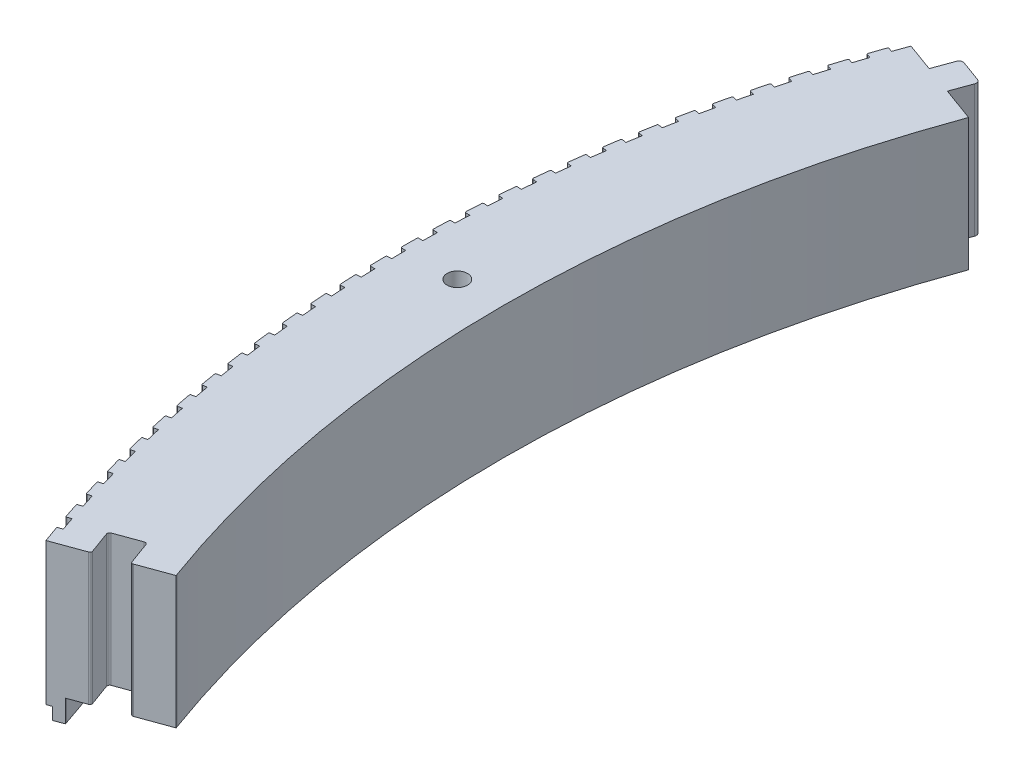
from build123d import *

# Parameters (mm, degrees)
CUT_EXTRUDE4_DEPTH         = 448.090797114
TONGUE_DEPTH               = 33.02
GROOVE_REACH               = 337.962
NOTCH_DEPTH                = 336.961837561
FILLET_NOTCH_R             = 0.254
CIRPATTERN_NOTCHES_START   = -35.56
CIRPATTERN_NOTCHES_DEPTH   = 35.56
CUT_EXTRUDE6_DEPTH         = 38.608
SKETCH4_R                  = 2.1971
HOLES_MOUNTINGBOTTOM_DEPTH = 27.94
SKETCH9_R                  = 2.5527
HOLES_MOUNTINGTOP_DEPTH    = 336.365614775
HEXHOLE_DEPTH              = 25.4
SKETCH13_W                 = 8.8519
SKETCH13_H                 = 33.02
EXTENDLENGTH_DEPTH         = 0.3556
FILLET_GROOVE_R            = 0.508
RELIEF_VERSIONNUMBER_DEPTH = 0.6


# Read off the part's stored shape, not the designer's step: CirPattern-Notches
with BuildPart() as part:
    # Sketch1 → Revolve1 (revolve)
    with BuildSketch(Plane.XY, mode=Mode.PRIVATE) as revolve1_sk:
        Polygon((-289.56, 0), (-314.96, 0), (-314.96, -35.56), (-313.69, -35.56), (-313.69, -38.608), (-311.15, -38.608), (-311.15, -33.02), (-289.56, -33.02), align=None)
    revolve(revolve1_sk.sketch.rotate(Axis((0, 4.1402, 0), (0, -1, 0)), 270), axis=Axis((0, 4.1402, 0), (0, -1, 0)))

    # Sketch3 → Cut-Extrude4 (cut, through all)
    with BuildSketch(Plane(origin=(0, 0, 0), x_dir=(1, 0, 0), z_dir=(0, 1, 0))):
        with BuildLine():
            Line((-340.36, 123.880908935), (0, 0))
            Line((0, 0), (-170.18, -61.940454467))
            Line((-170.18, -61.940454467), (-170.180868731, -61.938067648))
            Line((-170.180868731, -61.938067648), (-340.36, -123.878205923))
            Line((-340.36, -123.878205923), (-340.36, -123.880908935))
            ThreePointArc((-340.36, -123.880908935), (362.20354664, 0), (-340.36, 123.880908935))
        make_face()
    extrude(amount=-CUT_EXTRUDE4_DEPTH, mode=Mode.SUBTRACT)

    # Sketch5 → Tongue (add)
    with BuildSketch(Plane(origin=(0, 0, 0), x_dir=(1, 0, 0), z_dir=(0, 1, 0))):
        with BuildLine():
            Line((-280.451262674, 102.075911776), (-278.626927229, 107.088232215))
            ThreePointArc((-278.626927229, 107.088232215), (-278.66084622, 107.865104834), (-279.234162466, 108.390452383))
            Line((-279.234162466, 108.390452383), (-284.485164831, 110.301660944))
            ThreePointArc((-284.485164831, 110.301660944), (-285.262037451, 110.267741953), (-285.787384999, 109.694425707))
            Line((-285.787384999, 109.694425707), (-287.611720444, 104.682105268))
            Line((-287.611720444, 104.682105268), (-280.451262674, 102.075911776))
        make_face()
    extrude(amount=-TONGUE_DEPTH)

    # Sketch6 → Groove (cut, up to next)
    with BuildSketch(Plane(origin=(0, 0, 0), x_dir=(1, 0, 0), z_dir=(0, 1, 0)), mode=Mode.PRIVATE) as groove_sk1:
        with BuildLine():
            Line((-128.707819823, -518.876197579), (-280.416329106, -102.060493985))
            Line((-280.416329106, -102.060493985), (-282.457847341, -96.451468732))
            ThreePointArc((-282.457847341, -96.451468732), (-282.786189559, -96.093146078), (-283.271734947, -96.071946709))
            Line((-283.271734947, -96.071946709), (-289.310387666, -98.269836554))
            ThreePointArc((-289.310387666, -98.269836554), (-289.66871032, -98.598178772), (-289.689909689, -99.083724159))
            Line((-289.689909689, -99.083724159), (-287.648391454, -104.692749412))
            Line((-287.648391454, -104.692749412), (-135.939882171, -521.508453006))
            Line((-135.939882171, -521.508453006), (167.477136395, -1355.139860195))
            Line((167.477136395, -1355.139860195), (174.709198743, -1352.507604768))
            Line((174.709198743, -1352.507604768), (-128.707819823, -518.876197579))
        make_face()
    groove_tool1 = extrude(groove_sk1.sketch, amount=-GROOVE_REACH, mode=Mode.PRIVATE) & part.part
    add(groove_tool1.solids().sort_by_distance((-57.595102, 0, 725.507875))[0], mode=Mode.SUBTRACT)

    # Sketch7 → Notch (cut, through all)
    with BuildSketch(Plane(origin=(0, 0, 0), x_dir=(1, 0, 0), z_dir=(0, 1, 0))):
        with BuildLine():
            Line((-296.152118835, -103.418270192), (-297.351115267, -103.836967642))
            ThreePointArc((-297.351115267, -103.836967642), (-297.935324969, -102.148635505), (-298.509948564, -100.457016721))
            Line((-298.509948564, -100.457016721), (-297.306279416, -100.051948106))
            ThreePointArc((-297.306279416, -100.051948106), (-296.733972852, -101.736745845), (-296.152118835, -103.418270192))
        make_face()
    extrude(amount=-NOTCH_DEPTH, mode=Mode.SUBTRACT)

    # Fillet-Notch
    fillet_notch_edges = [part.edges().sort_by_distance(p)[0] for p in [
        (-297.351115267, -17.78, 103.836967642),
        (-298.509948564, -17.78, 100.457016721),
    ]]
    fillet(fillet_notch_edges, radius=FILLET_NOTCH_R)

    # CirPattern-Notches outline → CirPattern-Notches (cut)
    with BuildSketch(Plane(origin=(0, 0, 0), x_dir=(1, 0, 0), z_dir=(0, 1, 0)).offset(CIRPATTERN_NOTCHES_START)):
        with BuildLine():
            ThreePointArc((-296.049225252, 103.712450206), (-295.456175483, 105.390058682), (-294.853619373, 107.064276219))
            Line((-294.853619373, 107.064276219), (-295.808923812, 107.411156744))
            ThreePointArc((-295.808923812, 107.411156744), (-295.949150754, 107.535782222), (-295.965587843, 107.722664342))
            ThreePointArc((-295.965587843, 107.722664342), (-296.6548527, 105.809734758), (-297.331753767, 103.892395304))
            ThreePointArc((-297.331753767, 103.892395304), (-297.202186047, 104.037452641), (-297.007992402, 104.048327086))
            Line((-297.007992402, 104.048327086), (-296.049225252, 103.712450206))
        make_face()
        with BuildLine():
            ThreePointArc((-298.54187051, 96.302479991), (-297.990812137, 97.994346681), (-297.430165872, 99.683060391))
            Line((-297.430165872, 99.683060391), (-298.393405254, 100.005887933))
            ThreePointArc((-298.393405254, 100.005887933), (-298.540105496, 100.133592529), (-298.553459144, 100.327631455))
            ThreePointArc((-298.553459144, 100.327631455), (-299.197252673, 98.391084927), (-299.828485072, 96.450407668))
            ThreePointArc((-299.828485072, 96.450407668), (-299.702572525, 96.598648875), (-299.50871019, 96.614359389))
            Line((-299.50871019, 96.614359389), (-298.54187051, 96.302479991))
        make_face()
        with BuildLine():
            ThreePointArc((-300.849079824, 88.832692568), (-300.340355132, 90.537766588), (-299.821966951, 92.239927544))
            Line((-299.821966951, 92.239927544), (-300.792952275, 92.538650205))
            ThreePointArc((-300.792952275, 92.538650205), (-300.942789448, 92.662659264), (-300.960974538, 92.856305146))
            ThreePointArc((-300.960974538, 92.856305146), (-301.556307988, 90.904316251), (-302.138981268, 88.94851094))
            ThreePointArc((-302.138981268, 88.94851094), (-302.016802103, 89.099843939), (-301.823391493, 89.120380764))
            Line((-301.823391493, 89.120380764), (-300.849079824, 88.832692568))
        make_face()
        with BuildLine():
            ThreePointArc((-302.969420098, 81.307727711), (-302.503345075, 83.024949974), (-302.027536968, 84.739500899))
            Line((-302.027536968, 84.739500899), (-303.005665118, 85.013933131))
            ThreePointArc((-303.005665118, 85.013933131), (-303.158546151, 85.134169626), (-303.181551389, 85.327302181))
            ThreePointArc((-303.181551389, 85.327302181), (-303.728054975, 83.361083375), (-304.261807215, 81.391364839))
            ThreePointArc((-304.261807215, 81.391364839), (-304.143437323, 81.545695632), (-303.950598573, 81.57104601))
            Line((-303.950598573, 81.57104601), (-302.969420098, 81.307727711))
        make_face()
        with BuildLine():
            ThreePointArc((-304.901574305, 73.732259469), (-304.478438448, 75.460563341), (-304.045505959, 77.18643926))
            Line((-304.045505959, 77.18643926), (-305.030169382, 77.436410603))
            ThreePointArc((-305.030169382, 77.436410603), (-305.185999315, 77.55279985), (-305.21381041, 77.745299118))
            ThreePointArc((-305.21381041, 77.745299118), (-305.711144678, 75.766071695), (-306.195644344, 73.783663402))
            ThreePointArc((-306.195644344, 73.783663402), (-306.081157248, 73.940896128), (-305.889010138, 73.971044314))
            Line((-305.889010138, 73.971044314), (-304.901574305, 73.732259469))
        make_face()
        with BuildLine():
            ThreePointArc((-306.644342309, 66.110993259), (-306.264408445, 67.849305223), (-305.874620485, 69.585434128))
            Line((-305.874620485, 69.585434128), (-306.865207567, 69.810789314))
            ThreePointArc((-306.865207567, 69.810789314), (-307.023889609, 69.92325902), (-307.056489287, 70.115005431))
            ThreePointArc((-307.056489287, 70.115005431), (-307.504345322, 68.123998767), (-307.939291473, 66.130132068))
            ThreePointArc((-307.939291473, 66.130132068), (-307.828758286, 66.290169063), (-307.637422166, 66.325096331))
            Line((-307.637422166, 66.325096331), (-306.644342309, 66.110993259))
        make_face()
        with BuildLine():
            ThreePointArc((-308.19664161, 58.448662944), (-307.860145731, 60.195903268), (-307.513744412, 61.941206781))
            Line((-307.513744412, 61.941206781), (-308.509639862, 62.141805835))
            ThreePointArc((-308.509639862, 62.141805835), (-308.671075447, 62.250286141), (-308.708443461, 62.441160593))
            ThreePointArc((-308.708443461, 62.441160593), (-309.106543083, 60.439611379), (-309.491665555, 58.435524742))
            ThreePointArc((-309.491665555, 58.435524742), (-309.385154934, 58.598266601), (-309.19474865, 58.637951256))
            Line((-309.19474865, 58.637951256), (-308.19664161, 58.448662944))
        make_face()
        with BuildLine():
            ThreePointArc((-309.557508015, 50.750027897), (-309.26465913, 52.505111301), (-308.961859616, 54.258505347))
            Line((-308.961859616, 54.258505347), (-309.962444844, 54.434223667))
            ThreePointArc((-309.962444844, 54.434223667), (-310.1265337, 54.538647191), (-310.168646837, 54.728531126))
            ThreePointArc((-310.168646837, 54.728531126), (-310.516742771, 52.717682602), (-310.851802352, 50.704620844))
            ThreePointArc((-310.851802352, 50.704620844), (-310.749380454, 50.869966482), (-310.560022274, 50.914383873))
            Line((-310.560022274, 50.914383873), (-309.557508015, 50.750027897))
        make_face()
        with BuildLine():
            ThreePointArc((-310.726096235, 43.019870037), (-310.477076246, 44.781706372), (-310.218066616, 46.54210185))
            Line((-310.218066616, 46.54210185), (-311.222720121, 46.692830291))
            ThreePointArc((-311.222720121, 46.692830291), (-311.389360326, 46.793132171), (-311.436192428, 46.981907644))
            ThreePointArc((-311.436192428, 46.981907644), (-311.734068458, 44.963008826), (-312.018857028, 42.942222337))
            ThreePointArc((-312.018857028, 42.942222337), (-311.920587472, 43.110069052), (-311.732395014, 43.159191591))
            Line((-311.732395014, 43.159191591), (-310.726096235, 43.019870037))
        make_face()
        with BuildLine():
            ThreePointArc((-311.701680417, 35.262990866), (-311.496643998, 37.030485786), (-311.281585135, 38.796789246))
            Line((-311.281585135, 38.796789246), (-312.289682886, 38.922434186))
            ThreePointArc((-312.289682886, 38.922434186), (-312.458770933, 39.018552121), (-312.510292912, 39.206101876))
            ThreePointArc((-312.510292912, 39.206101876), (-312.757764015, 37.180406781), (-312.992104681, 35.15315075))
            ThreePointArc((-312.992104681, 35.15315075), (-312.898048506, 35.323394284), (-312.711138664, 35.377191459))
            Line((-312.711138664, 35.377191459), (-311.701680417, 35.262990866))
        make_face()
        with BuildLine():
            ThreePointArc((-312.483654587, 27.484208483), (-312.322729094, 29.256264129), (-312.151754578, 31.027378451))
            Line((-312.151754578, 31.027378451), (-313.162670408, 31.127861845))
            ThreePointArc((-313.162670408, 31.127861845), (-313.334101269, 31.219736133), (-313.390281122, 31.405943677))
            ThreePointArc((-313.390281122, 31.405943677), (-313.587193585, 29.374710542), (-313.770940789, 27.342244176))
            ThreePointArc((-313.770940789, 27.342244176), (-313.681156416, 27.514778785), (-313.495645288, 27.573217181))
            Line((-313.495645288, 27.573217181), (-312.483654587, 27.484208483))
        make_face()
        with BuildLine():
            ThreePointArc((-313.071533029, 19.688354591), (-312.954818421, 21.46387027), (-312.828034451, 23.238695346))
            Line((-312.828034451, 23.238695346), (-313.84114044, 23.313954782))
            ThreePointArc((-313.84114044, 23.313954782), (-314.014807633, 23.401528356), (-314.075610465, 23.586278026))
            ThreePointArc((-314.075610465, 23.586278026), (-314.221841978, 21.55076853), (-314.354881587, 19.514354273))
            ThreePointArc((-314.354881587, 19.514354273), (-314.269424786, 19.68907279), (-314.085427598, 19.752116107))
            Line((-314.085427598, 19.752116107), (-313.071533029, 19.688354591))
        make_face()
        with BuildLine():
            ThreePointArc((-313.464950591, 11.880271497), (-313.392519362, 13.658144368), (-313.310004689, 15.435577786))
            Line((-313.310004689, 15.435577786), (-314.324671557, 15.485566516))
            ThreePointArc((-314.324671557, 15.485566516), (-314.500467212, 15.568784981), (-314.565855255, 15.751962023))
            ThreePointArc((-314.565855255, 15.751962023), (-314.661314988, 13.713440499), (-314.743564366, 11.674343247))
            ThreePointArc((-314.743564366, 11.674343247), (-314.662488217, 11.851137147), (-314.480119258, 11.918746228))
            Line((-314.480119258, 11.918746228), (-313.464950591, 11.880271497))
        make_face()
        with BuildLine():
            ThreePointArc((-313.663662904, 4.064809106), (-313.635560045, 5.843934862), (-313.597365922, 7.622872589))
            Line((-313.597365922, 7.622872589), (-314.612963421, 7.647559564))
            ThreePointArc((-314.612963421, 7.647559564), (-314.790778343, 7.726371229), (-314.860710983, 7.907861865))
            ThreePointArc((-314.860710983, 7.907861865), (-314.905339641, 5.867594518), (-314.936747701, 3.827080833))
            ThreePointArc((-314.936747701, 3.827080833), (-314.860102563, 4.005840302), (-314.679475109, 4.077973152))
            Line((-314.679475109, 4.077973152), (-313.663662904, 4.064809106))
        make_face()
        with BuildLine():
            ThreePointArc((-313.667546542, -3.753178095), (-313.683789509, -1.973904537), (-313.689939659, -0.194567469))
            Line((-313.689939659, -0.194567469), (-314.705836962, -0.195197584))
            ThreePointArc((-314.705836962, -0.195197584), (-314.885560704, -0.120841672), (-314.959994502, 0.058849827))
            ThreePointArc((-314.959994502, 0.058849827), (-314.953764366, -1.981896054), (-314.934311597, -4.022558729))
            ThreePointArc((-314.934311597, -4.022558729), (-314.862145078, -3.841944725), (-314.683371324, -3.765332911))
            Line((-314.683371324, -3.765332911), (-313.667546542, -3.753178095))
        make_face()
        with BuildLine():
            ThreePointArc((-313.476599092, -11.568834052), (-313.537177795, -9.790517869), (-313.587668399, -8.011886675))
            Line((-313.587668399, -8.011886675), (-314.603234492, -8.037833487))
            ThreePointArc((-314.603234492, -8.037833487), (-314.78475542, -7.967979513), (-314.863644143, -7.790198765))
            ThreePointArc((-314.863644143, -7.790198765), (-314.806559082, -9.830155593), (-314.736257569, -11.869699724))
            ThreePointArc((-314.736257569, -11.869699724), (-314.668614494, -11.687343371), (-314.491805483, -11.60630018))
            Line((-314.491805483, -11.60630018), (-313.476599092, -11.568834052))
        make_face()
        with BuildLine():
            ThreePointArc((-313.090939159, -19.377304157), (-313.19581597, -17.60104993), (-313.290615666, -15.824229386))
            Line((-313.290615666, -15.824229386), (-314.305219742, -15.87547678))
            ThreePointArc((-314.305219742, -15.87547678), (-314.488425107, -15.810168133), (-314.571719754, -15.634408562))
            ThreePointArc((-314.571719754, -15.634408562), (-314.463815225, -17.672309241), (-314.342708635, -19.709467988))
            ThreePointArc((-314.342708635, -19.709467988), (-314.279631019, -19.525482555), (-314.104896575, -19.440058325))
            Line((-314.104896575, -19.440058325), (-313.090939159, -19.377304157))
        make_face()
        with BuildLine():
            ThreePointArc((-312.510806291, -27.173738267), (-312.659916067, -25.400649296), (-312.798965971, -23.626743055))
            Line((-312.798965971, -23.626743055), (-313.81197782, -23.703259198))
            ThreePointArc((-313.81197782, -23.703259198), (-313.996753825, -23.642536444), (-314.084402659, -23.468907221))
            ThreePointArc((-314.084402659, -23.468907221), (-313.925745687, -25.503485932), (-313.753909243, -27.536993936))
            ThreePointArc((-313.753909243, -27.536993936), (-313.695436267, -27.351493704), (-313.522884923, -27.261741495))
            Line((-313.522884923, -27.261741495), (-312.510806291, -27.173738267))
        make_face()
        with BuildLine():
            ThreePointArc((-311.73656083, -34.953293713), (-311.929810955, -33.184471332), (-312.113024697, -31.414581236))
            Line((-312.113024697, -31.414581236), (-313.123815098, -31.516318602))
            ThreePointArc((-313.123815098, -31.516318602), (-313.310046973, -31.460219458), (-313.401995551, -31.288828431))
            ThreePointArc((-313.401995551, -31.288828431), (-313.192684684, -33.318821418), (-312.970225119, -35.347415588))
            ThreePointArc((-312.970225119, -35.347415588), (-312.916393103, -35.160515778), (-312.746132039, -35.06649134))
            Line((-312.746132039, -35.06649134), (-311.73656083, -34.953293713))
        make_face()
        with BuildLine():
            ThreePointArc((-310.768683693, -42.711138311), (-311.005954129, -40.947681204), (-311.233217909, -39.182906601))
            Line((-311.233217909, -39.182906601), (-312.241159021, -39.309801997))
            ThreePointArc((-312.241159021, -39.309801997), (-312.428731089, -39.258361308), (-312.524922299, -39.089314936))
            ThreePointArc((-312.524922299, -39.089314936), (-312.265087547, -41.113461291), (-311.992143042, -43.135881588))
            ThreePointArc((-311.992143042, -43.135881588), (-311.942985422, -42.947698291), (-311.775120392, -42.849460025))
            Line((-311.775120392, -42.849460025), (-310.768683693, -42.711138311))
        make_face()
        with BuildLine():
            ThreePointArc((-309.607776063, -50.442453364), (-309.888919434, -48.685456884), (-310.160092089, -46.926893943))
            Line((-310.160092089, -46.926893943), (-311.164557841, -47.078868548))
            ThreePointArc((-311.164557841, -47.078868548), (-311.353353594, -47.032118267), (-311.453727687, -46.865521549))
            ThreePointArc((-311.453727687, -46.865521549), (-311.143530444, -48.882563997), (-310.820270534, -50.897554219))
            ThreePointArc((-310.820270534, -50.897554219), (-310.775817844, -50.708204322), (-310.610453117, -50.605813248))
            Line((-310.610453117, -50.605813248), (-309.607776063, -50.442453364))
        make_face()
        with BuildLine():
            ThreePointArc((-308.254559026, -58.142436651), (-308.579400702, -56.392992136), (-308.894313797, -54.641733169))
            Line((-308.894313797, -54.641733169), (-309.894680275, -54.818692587))
            ThreePointArc((-309.894680275, -54.818692587), (-310.084582444, -54.776661751), (-310.189077075, -54.612618168))
            ThreePointArc((-310.189077075, -54.612618168), (-309.828710017, -56.621303845), (-309.455335491, -58.627612402))
            ThreePointArc((-309.455335491, -58.627612402), (-309.415615344, -58.437213518), (-309.252853633, -58.330733236))
            Line((-309.252853633, -58.330733236), (-308.254559026, -58.142436651))
        make_face()
        with BuildLine():
            ThreePointArc((-306.709873118, -65.806305413), (-307.078211328, -64.065499511), (-307.436669257, -62.322632293))
            Line((-307.436669257, -62.322632293), (-308.432315096, -62.524466608))
            ThreePointArc((-308.432315096, -62.524466608), (-308.623205726, -62.487181324), (-308.731755988, -62.32579277))
            ThreePointArc((-308.731755988, -62.32579277), (-308.321442953, -64.324874003), (-307.898185729, -66.3212547))
            ThreePointArc((-307.898185729, -66.3212547), (-307.863222795, -66.129925094), (-307.703165198, -66.019421742))
            Line((-307.703165198, -66.019421742), (-306.709873118, -65.806305413))
        make_face()
        with BuildLine():
            ThreePointArc((-304.974677802, -73.429299326), (-305.386283757, -71.698213319), (-305.788063869, -69.964820412))
            Line((-305.788063869, -69.964820412), (-306.778370634, -70.191404256))
            ThreePointArc((-306.778370634, -70.191404256), (-306.970131155, -70.158887684), (-307.082669624, -70.000254403))
            ThreePointArc((-307.082669624, -70.000254403), (-306.622665473, -71.988489486), (-306.149788452, -73.973702292))
            ThreePointArc((-306.149788452, -73.973702292), (-306.119604448, -73.781560806), (-305.962350384, -73.667103022))
            Line((-305.962350384, -73.667103022), (-304.974677802, -73.429299326))
        make_face()
        with BuildLine():
            ThreePointArc((-303.050050877, -81.00668345), (-303.504668912, -79.286392582), (-303.949521645, -77.563550665))
            Line((-303.949521645, -77.563550665), (-304.933874218, -77.814743298))
            ThreePointArc((-304.933874218, -77.814743298), (-305.126385521, -77.787015635), (-305.242842295, -77.631236161))
            ThreePointArc((-305.242842295, -77.631236161), (-304.733432753, -79.607390123), (-304.211229658, -81.580201947))
            ThreePointArc((-304.211229658, -81.580201947), (-304.185843333, -81.387367926), (-304.031490478, -81.269026805))
            Line((-304.031490478, -81.269026805), (-303.050050877, -81.00668345))
        make_face()
        with BuildLine():
            ThreePointArc((-300.937187802, -88.533751179), (-301.434535536, -86.825323991), (-301.922184575, -85.114103186))
            Line((-301.922184575, -85.114103186), (-302.899971537, -85.389748583))
            ThreePointArc((-302.899971537, -85.389748583), (-303.093114045, -85.366827052), (-303.213416788, -85.213998144))
            ThreePointArc((-303.213416788, -85.213998144), (-302.654918271, -87.176843521), (-302.083713462, -89.136028972))
            ThreePointArc((-302.083713462, -89.136028972), (-302.063140584, -88.942622194), (-301.911784812, -88.820471241))
            Line((-301.911784812, -88.820471241), (-300.937187802, -88.533751179))
        make_face()
        with BuildLine():
            ThreePointArc((-298.637400959, -96.005827158), (-299.177169471, -94.310324819), (-299.707311918, -92.611788034))
            Line((-299.707311918, -92.611788034), (-300.677925926, -92.91171498))
            ThreePointArc((-300.677925926, -92.91171498), (-300.871579672, -92.893613819), (-300.995653659, -92.743830406))
            ThreePointArc((-300.995653659, -92.743830406), (-300.388413072, -94.692147997), (-299.768561346, -96.636490149))
            ThreePointArc((-299.768561346, -96.636490149), (-299.752814694, -96.442630747), (-299.604550019, -96.316745835))
            Line((-299.604550019, -96.316745835), (-298.637400959, -96.005827158))
        make_face()
    extrude(amount=CIRPATTERN_NOTCHES_DEPTH, mode=Mode.SUBTRACT)

    # Sketch12 → Cut-Extrude6 (cut)
    with BuildSketch(Plane(origin=(0, 0, 0), x_dir=(1, 0, 0), z_dir=(0, 1, 0))):
        Polygon((-294.853619374, 107.064276219), (-294.772093111, 107.288267785), (-295.965587843, 107.722664342), (-296.128640315, 107.274681356), (-294.934890273, 106.840191873), align=None)
    extrude(amount=-CUT_EXTRUDE6_DEPTH, mode=Mode.SUBTRACT)

    # Sketch4 → Holes_MountingBottom (cut)
    with BuildSketch(Plane(origin=(0, -33.02, 0), x_dir=(1, 0, 0), z_dir=(0, 1, 0))):
        with Locations(Location((-290.73433324, -77.900754654, 0), (0, 0, 270))):
            Circle(SKETCH4_R)
        with Locations(Location((-290.733695665, 77.903134115, 0), (0, 0, 270))):
            Circle(SKETCH4_R)
    extrude(amount=HOLES_MOUNTINGBOTTOM_DEPTH, mode=Mode.SUBTRACT)

    # Sketch9 → Holes_MountingTop (cut, through all)
    with BuildSketch(Plane.XZ.offset(33.02)):
        with Locations(Location((-300.99, 0, 0), (0, 0, 270))):
            Circle(SKETCH9_R)
    extrude(amount=-HOLES_MOUNTINGTOP_DEPTH, mode=Mode.SUBTRACT)

    # Sketch10 → HexHole (cut)
    with BuildSketch(Plane.XZ.offset(33.02)):
        Polygon((-300.99, -5.499261314), (-296.2275, -2.749630657), (-296.2275, 2.749630657), (-300.99, 5.499261314), (-305.7525, 2.749630657), (-305.7525, -2.749630657), align=None)
    extrude(amount=-HEXHOLE_DEPTH, mode=Mode.SUBTRACT)

    # Sketch13 → ExtendLength (add)
    with BuildSketch(Plane(origin=(-0.000868731, 0, -0.002386819), x_dir=(0.9396926207859094, 0, -0.3420201433256661), z_dir=(0.3420201433256661, 0, 0.9396926207859094))):
        Polygon((-306.108099989, -33.02), (-306.108099989, 0), (-314.95999999, 0), (-314.95999999, -35.56), (-313.68999999, -35.56), (-313.68999999, -38.608), (-311.14999999, -38.608), (-311.14999999, -33.02), align=None)
        with Locations((-293.985949989, -16.51)):
            Rectangle(SKETCH13_W, SKETCH13_H)
    extrude(amount=EXTENDLENGTH_DEPTH)

    # Fillet-Groove
    fillet_groove_edges = [part.edges().sort_by_distance(p)[0] for p in [
        (-287.526769091, -16.51, 105.026904108),
        (-280.294706743, -16.51, 102.394648681),
    ]]
    fillet(fillet_groove_edges, radius=FILLET_GROOVE_R)

    # Sketch11 → Relief_VersionNumber (cut)
    with BuildSketch(Plane.XZ.offset(33.02)):
        with BuildLine():
            Line((-300.541054713, 41.182323244), (-300.635694136, 40.266457859))
            add(Edge.make_bspline(
                [(-300.635694136, 40.266457859), (-300.680297959, 40.277728851), (-300.767656284, 40.299803528), (-300.89342874, 40.34248923), (-301.010565396, 40.394064046), (-301.121418974, 40.45066948), (-301.224206805, 40.515860285), (-301.319216984, 40.588705866), (-301.407534331, 40.667635194), (-301.459509197, 40.726565777), (-301.485413687, 40.755937026)],
                knots=[0, 0, 0, 0, 1.106147182, 2.166432335, 3.189406384, 4.181836985, 5.157257191, 6.111746379, 7.058886503, 8, 8, 8, 8], degree=3))
            add(Edge.make_bspline(
                [(-301.485413687, 40.755937026), (-301.518917906, 40.798347269), (-301.585194597, 40.882241499), (-301.667267178, 41.018560722), (-301.735191742, 41.159803558), (-301.787700513, 41.307053872), (-301.822579824, 41.460539221), (-301.844593109, 41.619169514), (-301.849661554, 41.783942761), (-301.840939215, 41.895046035), (-301.836495418, 41.951650167)],
                knots=[0, 0, 0, 0, 1.011216199, 2.000347036, 2.971987961, 3.942320027, 4.920685191, 5.914211464, 6.937346783, 8, 8, 8, 8], degree=3))
            add(Edge.make_bspline(
                [(-301.836495418, 41.951650167), (-301.830359211, 42.002022044), (-301.818318551, 42.100863326), (-301.783678067, 42.244028712), (-301.739341983, 42.380239849), (-301.682137282, 42.508663604), (-301.613449547, 42.629527288), (-301.533977272, 42.742886919), (-301.442607381, 42.848584234), (-301.340455831, 42.944992593), (-301.231489803, 43.032288128), (-301.117673, 43.106629778), (-301.000487227, 43.167572908), (-300.880005975, 43.214495809), (-300.756189605, 43.248282292), (-300.629007653, 43.268935032), (-300.498554995, 43.27520626), (-300.411109585, 43.268691421), (-300.36704029, 43.26540818)],
                knots=[0, 0, 0, 0, 1.110241939, 2.178551705, 3.21902822, 4.243125828, 5.250961499, 6.258578206, 7.269610804, 8.304558768, 9.329948342, 10.32289559, 11.27627665, 12.216930053, 13.148449252, 14.0813295, 15.033060083, 16, 16, 16, 16], degree=3))
            add(Edge.make_bspline(
                [(-300.36704029, 43.26540818), (-300.312769255, 43.257488169), (-300.20545283, 43.241827011), (-300.051261114, 43.190855255), (-299.906938621, 43.117635072), (-299.773552907, 43.022314639), (-299.651566337, 42.907354017), (-299.546893782, 42.770721572), (-299.454295915, 42.616973835), (-299.408583477, 42.503612124), (-299.385029072, 42.445199847)],
                knots=[0, 0, 0, 0, 0.972398042, 1.922835634, 2.868298281, 3.835928034, 4.824329516, 5.832769367, 6.883283633, 8, 8, 8, 8], degree=3))
            add(Edge.make_bspline(
                [(-299.385029072, 42.445199847), (-299.369169913, 42.481012327), (-299.337885267, 42.551657992), (-299.284414982, 42.652576216), (-299.223476579, 42.745432359), (-299.158761706, 42.832572883), (-299.086803562, 42.912150238), (-299.010013416, 42.985528579), (-298.926471956, 43.050978855), (-298.838613161, 43.109992984), (-298.745319697, 43.160636903), (-298.649583099, 43.205007325), (-298.549544941, 43.237902683), (-298.447841997, 43.265360422), (-298.342719401, 43.281550455), (-298.235049255, 43.292986645), (-298.124366555, 43.292038527), (-298.049871646, 43.286515065), (-298.012248623, 43.283725488)],
                knots=[0, 0, 0, 0, 1.084132067, 2.138618386, 3.157031526, 4.156170274, 5.140325648, 6.123405247, 7.092800501, 8.074668443, 9.049687108, 10.028902138, 10.991038638, 11.961297658, 12.941592705, 13.932044666, 14.95559665, 16, 16, 16, 16], degree=3))
            add(Edge.make_bspline(
                [(-298.012248623, 43.283725488), (-297.957084576, 43.27638748), (-297.848784205, 43.261981197), (-297.691849066, 43.22103952), (-297.542145675, 43.1678747), (-297.401395065, 43.096706447), (-297.268365148, 43.011902133), (-297.143351085, 42.912518507), (-297.026895215, 42.797763047), (-296.920240736, 42.669127951), (-296.823665145, 42.530732296), (-296.741633294, 42.383669216), (-296.676403255, 42.228928815), (-296.626320824, 42.067355463), (-296.591812533, 41.898621975), (-296.572502338, 41.723223578), (-296.569351263, 41.540606759), (-296.579384518, 41.417346593), (-296.584516251, 41.354302411)],
                knots=[0, 0, 0, 0, 0.995872349, 1.95513837, 2.898789759, 3.836161842, 4.773218855, 5.72015021, 6.691081213, 7.696103398, 8.708972793, 9.709780953, 10.706172063, 11.711194247, 12.734703491, 13.786035969, 14.867618334, 16, 16, 16, 16], degree=3))
            add(Edge.make_bspline(
                [(-296.584516251, 41.354302411), (-296.592094238, 41.295141329), (-296.606961847, 41.179070416), (-296.644212136, 41.010441551), (-296.697005417, 40.852659949), (-296.759239334, 40.703441928), (-296.837810252, 40.565797431), (-296.927157529, 40.436586107), (-297.031018927, 40.31795006), (-297.146588735, 40.209628033), (-297.272194927, 40.11258631), (-297.408395569, 40.03114637), (-297.551803488, 39.960812315), (-297.705579366, 39.907857231), (-297.866721279, 39.86611577), (-298.037015835, 39.842216847), (-298.215539354, 39.827388309), (-298.337525094, 39.83106585), (-298.399964969, 39.832948244)],
                knots=[0, 0, 0, 0, 1.08132285, 2.121498228, 3.125240182, 4.095299462, 5.048279451, 5.993665219, 6.939791156, 7.90154545, 8.862433794, 9.811893314, 10.774827193, 11.753430336, 12.756002977, 13.7886391, 14.868088193, 16, 16, 16, 16], degree=3))
            Line((-298.399964969, 39.832948244), (-298.302272662, 40.775271962))
            add(Edge.make_bspline(
                [(-298.302272662, 40.775271962), (-298.270358495, 40.777679436), (-298.208399345, 40.782353381), (-298.118180897, 40.794262518), (-298.033637792, 40.812228531), (-297.955380786, 40.837149737), (-297.882056234, 40.86526018), (-297.815032595, 40.899990882), (-297.753470102, 40.939650537), (-297.680383509, 40.999703994), (-297.600021906, 41.085803527), (-297.527540522, 41.208164533), (-297.4760132, 41.346096819), (-297.461885588, 41.444780462), (-297.454588367, 41.495752731)],
                knots=[0, 0, 0, 0, 0.936612588, 1.818368618, 2.661553776, 3.462288455, 4.220015785, 4.957104211, 5.667568699, 6.359121561, 7.722199423, 9.089428893, 10.496626071, 12, 12, 12, 12], degree=3))
            add(Edge.make_bspline(
                [(-297.454588367, 41.495752731), (-297.45237926, 41.523208894), (-297.448073421, 41.57672456), (-297.450351316, 41.656129762), (-297.459364221, 41.732455404), (-297.47551971, 41.806193418), (-297.499659281, 41.876701965), (-297.52825872, 41.945371129), (-297.567135551, 42.00980269), (-297.611130395, 42.071309658), (-297.660995475, 42.127760764), (-297.713721731, 42.179364159), (-297.771385721, 42.223324495), (-297.832548256, 42.26085564), (-297.896979339, 42.293007284), (-297.96566564, 42.31739792), (-298.038075455, 42.334658594), (-298.087818421, 42.341162809), (-298.112993816, 42.344454654)],
                knots=[0, 0, 0, 0, 1.101948942, 2.14784321, 3.173534087, 4.175032023, 5.162626028, 6.153946816, 7.14601128, 8.167288626, 9.177675907, 10.157209315, 11.115910337, 12.073071585, 13.026469216, 13.992832306, 14.984153094, 16, 16, 16, 16], degree=3))
            add(Edge.make_bspline(
                [(-298.112993816, 42.344454654), (-298.141135272, 42.346457902), (-298.196422444, 42.350393516), (-298.278831623, 42.345117376), (-298.358616984, 42.330062556), (-298.43582173, 42.30367767), (-298.511104216, 42.269348976), (-298.58416604, 42.224936384), (-298.654196729, 42.170758897), (-298.721473448, 42.107506099), (-298.784663309, 42.035273839), (-298.842010518, 41.953588749), (-298.891150129, 41.86209741), (-298.936722464, 41.7633133), (-298.973815345, 41.654684185), (-299.005263521, 41.537378035), (-299.030720525, 41.411258895), (-299.042267905, 41.323854651), (-299.048194136, 41.278997923)],
                knots=[0, 0, 0, 0, 0.855012317, 1.679771377, 2.49705123, 3.310500621, 4.148440361, 5.002523485, 5.897761404, 6.829507229, 7.799390002, 8.804176176, 9.849552012, 10.945507156, 12.100719855, 13.326240148, 14.627799845, 16, 16, 16, 16], degree=3))
            Line((-299.048194136, 41.278997923), (-299.864331957, 41.363461065))
            add(Edge.make_bspline(
                [(-299.864331957, 41.363461065), (-299.86404812, 41.417742152), (-299.863517189, 41.519277757), (-299.871922873, 41.661196603), (-299.889593469, 41.781869157), (-299.915836142, 41.88398396), (-299.952628984, 41.970421707), (-299.996405826, 42.046572449), (-300.049028717, 42.113894575), (-300.10979718, 42.171315001), (-300.176317489, 42.219284223), (-300.246230027, 42.257822736), (-300.320957535, 42.282404862), (-300.371987138, 42.290521743), (-300.397569136, 42.294590872)],
                knots=[0, 0, 0, 0, 1.639905266, 3.067528298, 4.29092484, 5.32019231, 6.243417822, 7.120608707, 7.967394256, 8.815605214, 9.637716904, 10.440171619, 11.218031794, 12, 12, 12, 12], degree=3))
            add(Edge.make_bspline(
                [(-300.397569136, 42.294590872), (-300.430522797, 42.296292249), (-300.494591037, 42.299600051), (-300.588857572, 42.28157925), (-300.67572309, 42.244065719), (-300.753992053, 42.188998741), (-300.820910652, 42.118278976), (-300.872348897, 42.032854941), (-300.90868738, 41.934390231), (-300.919219882, 41.863414588), (-300.924700546, 41.826481898)],
                knots=[0, 0, 0, 0, 1.000119547, 1.944424355, 2.886644415, 3.856274367, 4.833602298, 5.823788228, 6.867592419, 8, 8, 8, 8], degree=3))
            add(Edge.make_bspline(
                [(-300.924700546, 41.826481898), (-300.927062939, 41.792853557), (-300.931715707, 41.726622038), (-300.915244616, 41.628227129), (-300.887609076, 41.532164158), (-300.841272959, 41.441622589), (-300.782857112, 41.358467195), (-300.712734036, 41.286014884), (-300.631777118, 41.226198831), (-300.571427288, 41.197012169), (-300.541054713, 41.182323244)],
                knots=[0, 0, 0, 0, 1.005345075, 1.980042148, 2.965880179, 3.987238584, 5.006729094, 5.997310894, 6.99209614, 8, 8, 8, 8], degree=3))
        make_face()
        Polygon((-302.402798757, 35.252418765), (-302.301035936, 36.232394727), (-298.614168949, 37.123837034), (-302.039505488, 38.767306586), (-301.937742667, 39.747282547), (-297.118255488, 37.427090239), (-297.213912539, 36.50817197), align=None)
    extrude(amount=-RELIEF_VERSIONNUMBER_DEPTH, mode=Mode.SUBTRACT)


solid = part.part
